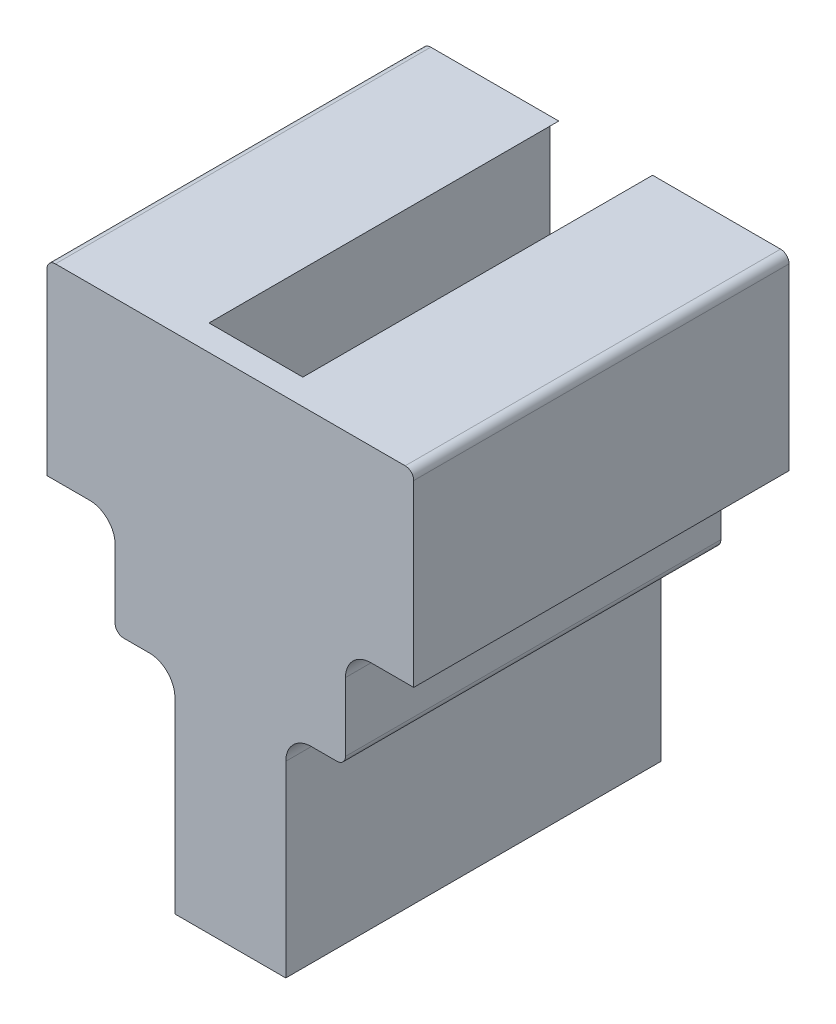
from build123d import *

# Parameters (mm, degrees)
CUT_EXTRUDE1_DEPTH = 41


with BuildPart() as part:
    # Sweep1: sweep along a path in Sketch3
    with BuildLine(Plane(origin=(0, 0, 0), x_dir=(0, 0, -1), z_dir=(1, 0, 0))) as sweep1_path:
        Line((0, 0), (44, 0))
    # Sketch4 → Sweep1 (sweep)
    with BuildSketch(Plane(origin=(0, 0, -44), x_dir=(-1, 0, 0), z_dir=(0, 0, -1))):
        with BuildLine():
            Line((-6.5, 0), (6.5, 0))
            Line((6.5, 0), (6.5, 22))
            ThreePointArc((6.5, 22), (7.378679656, 24.121320344), (9.5, 25))
            Line((9.5, 25), (12.5, 25))
            ThreePointArc((12.5, 25), (13.207106781, 25.292893219), (13.5, 26))
            Line((13.5, 26), (13.5, 34))
            ThreePointArc((13.5, 34), (14.378679656, 36.121320344), (16.5, 37))
            Line((16.5, 37), (21.5, 37))
            Line((21.5, 37), (21.5, 58))
            ThreePointArc((21.5, 58), (21.207106781, 58.707106781), (20.5, 59))
            Line((20.5, 59), (-20.5, 59))
            ThreePointArc((-20.5, 59), (-21.207106781, 58.707106781), (-21.5, 58))
            Line((-21.5, 58), (-21.5, 37))
            Line((-21.5, 37), (-16.5, 37))
            ThreePointArc((-16.5, 37), (-14.378679656, 36.121320344), (-13.5, 34))
            Line((-13.5, 34), (-13.5, 26))
            ThreePointArc((-13.5, 26), (-13.207106781, 25.292893219), (-12.5, 25))
            Line((-12.5, 25), (-9.5, 25))
            ThreePointArc((-9.5, 25), (-7.378679656, 24.121320344), (-6.5, 22))
            Line((-6.5, 22), (-6.5, 0))
        make_face()
    sweep(path=sweep1_path.line)

    # Sketch5 → Cut-Extrude1 (cut)
    with BuildSketch(Plane(origin=(0, 0, -44), x_dir=(-1, 0, 0), z_dir=(0, 0, -1))):
        with BuildLine():
            Line((-1, 0), (1, 0))
            ThreePointArc((1, 0), (1.353553391, 0.146446609), (1.5, 0.5))
            Line((1.5, 0.5), (1.5, 20))
            Line((1.5, 20), (2.5, 20))
            ThreePointArc((2.5, 20), (3.207106781, 20.292893219), (3.5, 21))
            Line((3.5, 21), (3.5, 26))
            ThreePointArc((3.5, 26), (3.792893219, 26.707106781), (4.5, 27))
            Line((4.5, 27), (5.5, 27))
            ThreePointArc((5.5, 27), (6.207106781, 27.292893219), (6.5, 28))
            Line((6.5, 28), (6.5, 58))
            ThreePointArc((6.5, 58), (6.207106781, 58.707106781), (5.5, 59))
            Line((5.5, 59), (-5.5, 59))
            ThreePointArc((-5.5, 59), (-6.207106781, 58.707106781), (-6.5, 58))
            Line((-6.5, 58), (-6.5, 28))
            ThreePointArc((-6.5, 28), (-6.207106781, 27.292893219), (-5.5, 27))
            Line((-5.5, 27), (-4.5, 27))
            ThreePointArc((-4.5, 27), (-3.792893219, 26.707106781), (-3.5, 26))
            Line((-3.5, 26), (-3.5, 21))
            ThreePointArc((-3.5, 21), (-3.207106781, 20.292893219), (-2.5, 20))
            Line((-2.5, 20), (-1.5, 20))
            Line((-1.5, 20), (-1.5, 0.5))
            ThreePointArc((-1.5, 0.5), (-1.353553391, 0.146446609), (-1, 0))
        make_face()
    extrude(amount=-CUT_EXTRUDE1_DEPTH, mode=Mode.SUBTRACT)


solid = part.part
